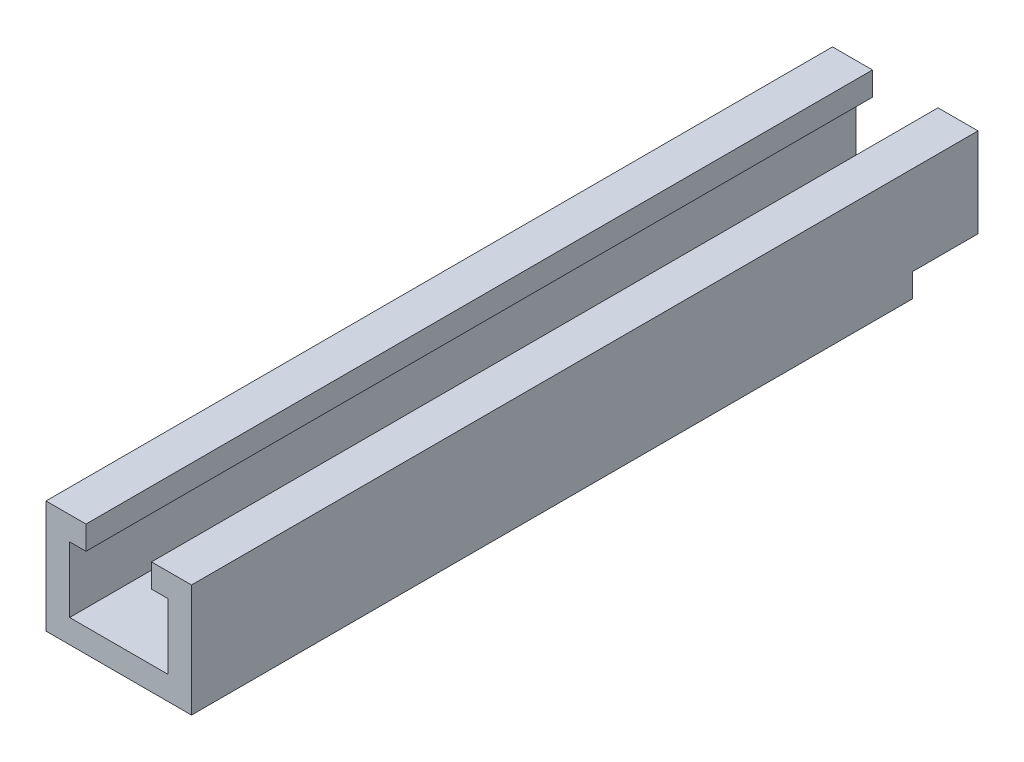
from build123d import *

# Parameters (mm, degrees)
SKETCH1_W                         = 111
SKETCH1_H                         = 18
BASEPLATE_DEPTH                   = 600
SKETCH2_W                         = 18
SKETCH2_H                         = 600
SIDE_RAIL_DEPTH                   = 50
SKETCH3_W                         = 30.5
SKETCH3_H                         = 600
KEEPER_RAIL_DEPTH                 = 18
SKETCH5_W                         = 111
SKETCH5_H                         = 50
LAP_JOINT_CUTOUT_DEPTH            = 18
LAP_JOINT_BOLT_HOLE_PATTERN_D     = 4.2
LAP_JOINT_BOLT_HOLE_PATTERN_DEPTH = 14
LAP_JOINT_BOLT_HOLE_PATTERN_TIP   = 1.2618073


with BuildPart() as part:
    # Sketch1 → baseplate (new body)
    with BuildSketch(Plane.XY):
        with Locations((55.5, 9)):
            Rectangle(SKETCH1_W, SKETCH1_H)
    extrude(amount=BASEPLATE_DEPTH)

    # Sketch2 → side_rail (add)
    with BuildSketch(Plane(origin=(0, 18, 0), x_dir=(1, 0, 0), z_dir=(0, 1, 0))):
        with Locations((9, -300)):
            Rectangle(SKETCH2_W, SKETCH2_H)
    side_rail = extrude(amount=SIDE_RAIL_DEPTH)

    # Sketch3 → keeper rail (add)
    with BuildSketch(Plane(origin=(0, 68, 0), x_dir=(1, 0, 0), z_dir=(0, 1, 0))):
        with Locations((15.25, -300)):
            Rectangle(SKETCH3_W, SKETCH3_H)
    keeper_rail = extrude(amount=KEEPER_RAIL_DEPTH)

    # mirror rails: side_rail, keeper rail across plane
    add(side_rail.mirror(Plane.ZY.offset(-55.5)))
    add(keeper_rail.mirror(Plane.ZY.offset(-55.5)))

    # Sketch5 → lap joint cutout (cut)
    with BuildSketch(Plane.XZ):
        with Locations((55.5, 25)):
            Rectangle(SKETCH5_W, SKETCH5_H)
    extrude(amount=-LAP_JOINT_CUTOUT_DEPTH, mode=Mode.SUBTRACT)

    # lap joint bolt hole pattern
    with Locations(Plane(origin=(0, 18, 0), x_dir=(-1, 0, 0), z_dir=(0, -1, 0))):
        with Locations((-102, -10), (-9, -40), (-102, -40), (-9, -10)):
            Hole(LAP_JOINT_BOLT_HOLE_PATTERN_D / 2, depth=LAP_JOINT_BOLT_HOLE_PATTERN_DEPTH)
            with Locations((0, 0, -(LAP_JOINT_BOLT_HOLE_PATTERN_DEPTH + LAP_JOINT_BOLT_HOLE_PATTERN_TIP / 2))):  # 118° drill point
                Cone(0, LAP_JOINT_BOLT_HOLE_PATTERN_D / 2, LAP_JOINT_BOLT_HOLE_PATTERN_TIP, mode=Mode.SUBTRACT)


solid = part.part
